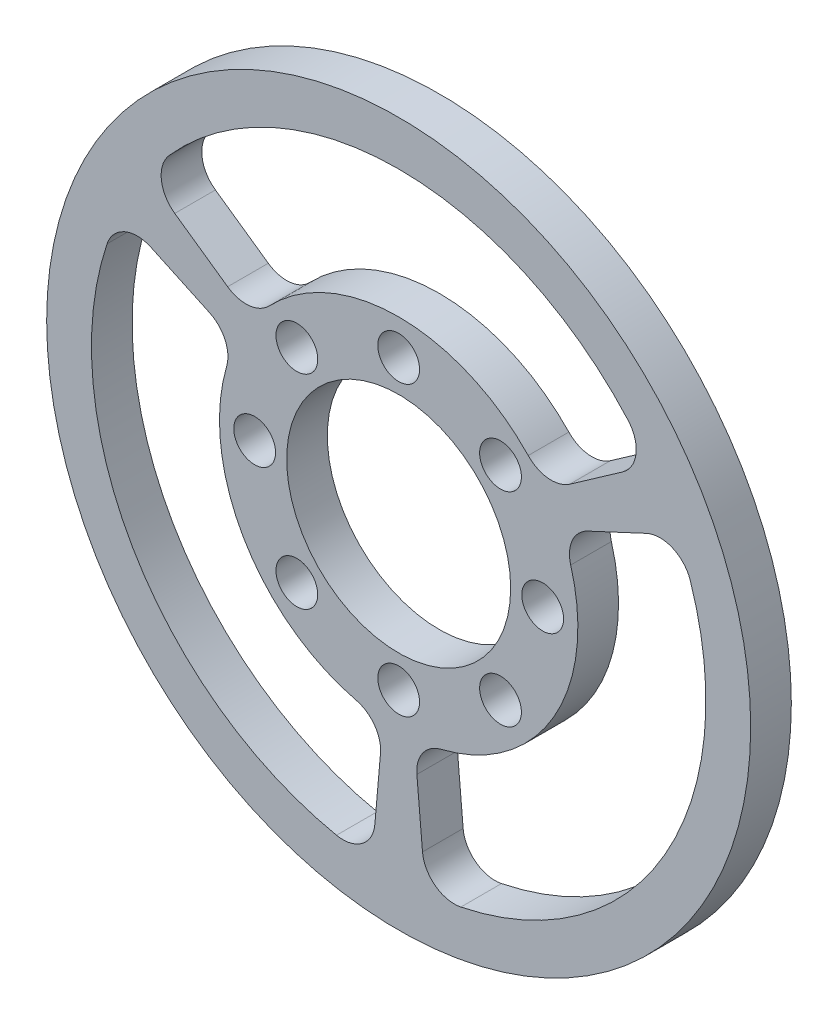
from build123d import *

# Parameters (mm, degrees)
SKETCH1_R           = 55
SKETCH1_R_2         = 3.2639
SKETCH1_R_3         = 17.5
BOSS_EXTRUDE1_DEPTH = 6.35
FILLET1_R           = 5


with BuildPart() as part:
    # Sketch1 → Boss-Extrude1 (new body)
    with BuildSketch(Plane.XY):
        Circle(SKETCH1_R)
        with Locations((0, 22.5)):
            Circle(SKETCH1_R_2, mode=Mode.SUBTRACT)
        with Locations((15.909902577, 15.909902577)):
            Circle(SKETCH1_R_2, mode=Mode.SUBTRACT)
        with Locations((22.5, 0)):
            Circle(SKETCH1_R_2, mode=Mode.SUBTRACT)
        with Locations((15.909902577, -15.909902577)):
            Circle(SKETCH1_R_2, mode=Mode.SUBTRACT)
        with Locations((0, -22.5)):
            Circle(SKETCH1_R_2, mode=Mode.SUBTRACT)
        with Locations((-15.909902577, -15.909902577)):
            Circle(SKETCH1_R_2, mode=Mode.SUBTRACT)
        with Locations((-22.5, 0)):
            Circle(SKETCH1_R_2, mode=Mode.SUBTRACT)
        with Locations((-15.909902577, 15.909902577)):
            Circle(SKETCH1_R_2, mode=Mode.SUBTRACT)
        Circle(SKETCH1_R_3, mode=Mode.SUBTRACT)
        with BuildLine():
            Line((-39.319298126, 27.531668945), (-22.93625724, 16.060140218))
            ThreePointArc((-22.93625724, 16.060140218), (0, 28), (22.93625724, 16.060140218))
            Line((22.93625724, 16.060140218), (39.319298126, 27.531668945))
            ThreePointArc((39.319298126, 27.531668945), (0, 48), (-39.319298126, 27.531668945))
        make_face(mode=Mode.SUBTRACT)
        with BuildLine():
            Line((43.502773778, 20.285676564), (25.376618037, 11.833311329))
            ThreePointArc((25.376618037, 11.833311329), (24.248711306, -14), (2.440360797, -27.893451547))
            Line((2.440360797, -27.893451547), (4.183475652, -47.817345508))
            ThreePointArc((4.183475652, -47.817345508), (41.569219382, -24), (43.502773778, 20.285676564))
        make_face(mode=Mode.SUBTRACT)
        with BuildLine():
            Line((-4.183475652, -47.817345508), (-2.440360797, -27.893451547))
            ThreePointArc((-2.440360797, -27.893451547), (-24.248711306, -14), (-25.376618037, 11.833311329))
            Line((-25.376618037, 11.833311329), (-43.502773778, 20.285676564))
            ThreePointArc((-43.502773778, 20.285676564), (-41.569219382, -24), (-4.183475652, -47.817345508))
        make_face(mode=Mode.SUBTRACT)
    extrude(amount=BOSS_EXTRUDE1_DEPTH)

    # Fillet1
    fillet1_edges = [part.edges().sort_by_distance(p)[0] for p in [
        (-2.440360797, -27.893451547, 3.175),
        (-25.376618037, 11.833311329, 3.175),
        (-43.502773778, 20.285676564, 3.175),
        (25.376618037, 11.833311329, 3.175),
        (2.440360797, -27.893451547, 3.175),
        (4.183475652, -47.817345508, 3.175),
        (43.502773778, 20.285676564, 3.175),
        (-22.93625724, 16.060140218, 3.175),
        (22.93625724, 16.060140218, 3.175),
        (39.319298126, 27.531668945, 3.175),
        (-39.319298126, 27.531668945, 3.175),
        (-4.183475652, -47.817345508, 3.175),
    ]]
    fillet(fillet1_edges, radius=FILLET1_R)


solid = part.part
